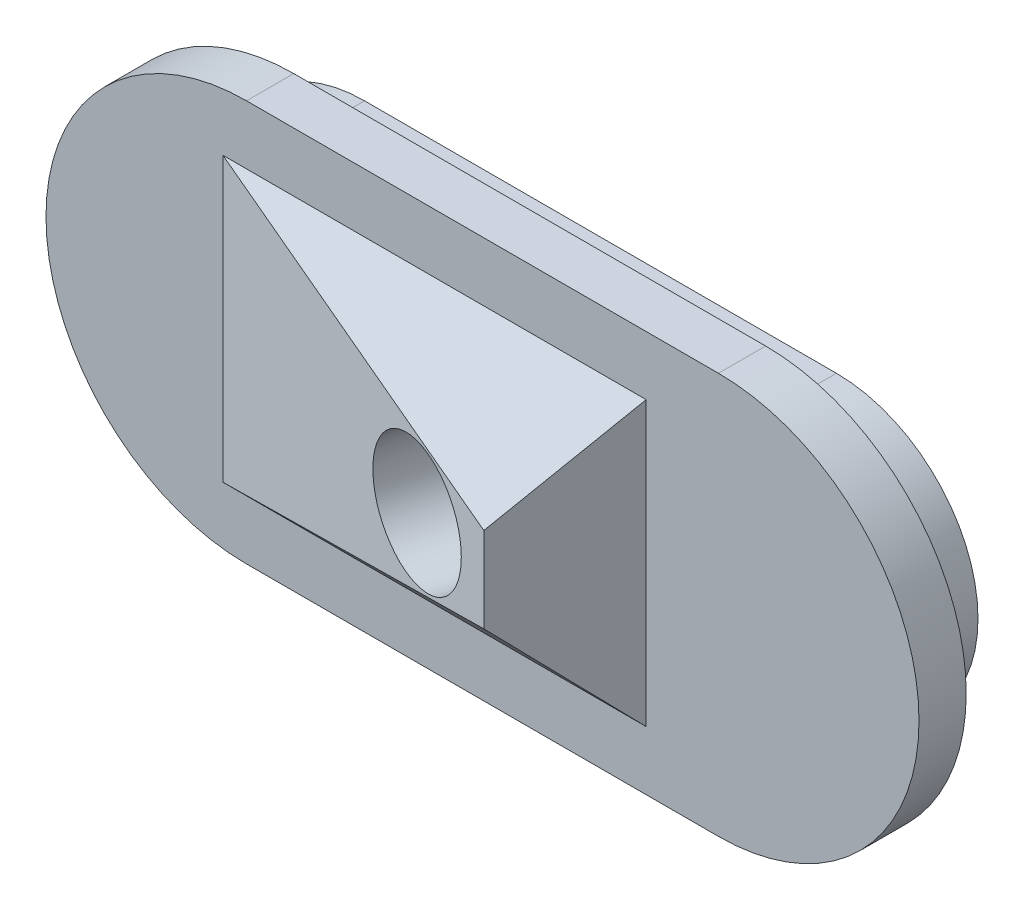
from build123d import *

# Parameters (mm, degrees)
BOSS_EXTRUDE1_DEPTH             = 5
BOSS_EXTRUDE2_REACH             = 19.804
BOSS_EXTRUDE2_DIRECTION_2_REACH = 19.804
BOSS_EXTRUDE3_DEPTH             = 2
SKETCH4_R                       = 2.65
CUT_EXTRUDE1_DEPTH              = 29.091194779
SKETCH9_W                       = 64.865756982
SKETCH9_H                       = 28.956889813
CUT_EXTRUDE2_DEPTH              = 32.5
CUT_EXTRUDE3_DEPTH              = 29.618053883
CHAMFER3_SIZE                   = 3
CHAMFER3_SIZE_2                 = 4.914912266


with BuildPart() as part:
    # Sketch2 → Boss-Extrude1 (new, symmetric)
    with BuildSketch(Plane.XY):
        with BuildLine():
            Line((-10, 6), (10, 6))
            ThreePointArc((10, 6), (16, 0), (10, -6))
            Line((10, -6), (-10, -6))
            ThreePointArc((-10, -6), (-16, 0), (-10, 6))
        make_face()
    extrude(amount=BOSS_EXTRUDE1_DEPTH, both=True)

    # Boss-Extrude2: up to this face of the body (flat: up to its plane)
    boss_extrude2_end = Plane(part.part.faces().sort_by_distance((0, 6, 0))[0])
    # Sketch3 → Boss-Extrude2 (add, up to the picked face)
    with BuildSketch(Plane(origin=(0, 0, 0), x_dir=(1, 0, 0), z_dir=(0, 1, 0)), mode=Mode.PRIVATE) as boss_extrude2_sk1:
        Polygon((-5, 5), (-5, 9.823085464), (13, 5), align=None)
    boss_extrude2_tool1 = split(extrude(boss_extrude2_sk1.sketch, amount=BOSS_EXTRUDE2_REACH, mode=Mode.PRIVATE), bisect_by=boss_extrude2_end, keep=Keep.BOTH, mode=Mode.PRIVATE)
    # Sketch3 → Boss-Extrude2 (add, up to the picked face)
    with BuildSketch(Plane(origin=(0, 0, 0), x_dir=(1, 0, 0), z_dir=(0, 1, 0)), mode=Mode.PRIVATE) as boss_extrude2_sk2:
        Polygon((-11, -5), (7, -9.823085464), (7, -5), align=None)
    boss_extrude2_tool2 = split(extrude(boss_extrude2_sk2.sketch, amount=BOSS_EXTRUDE2_REACH, mode=Mode.PRIVATE), bisect_by=boss_extrude2_end, keep=Keep.BOTH, mode=Mode.PRIVATE)
    add(boss_extrude2_tool1.solids().sort_by(Axis((1, 0, -6.607695), (0, 1, 0)))[0])
    add(boss_extrude2_tool2.solids().sort_by(Axis((1, 0, 6.607695), (0, 1, 0)))[0])

    # Boss-Extrude2 direction 2: up to this face of the body (flat: up to its plane)
    boss_extrude2_direction_2_end = Plane(part.part.faces().sort_by_distance((0, -6, 0))[0])
    # Sketch3 → Boss-Extrude2 direction 2 (add, up to the picked face)
    with BuildSketch(Plane(origin=(0, 0, 0), x_dir=(1, 0, 0), z_dir=(0, 1, 0)), mode=Mode.PRIVATE) as boss_extrude2_direction_2_sk1:
        Polygon((-5, 5), (-5, 9.823085464), (13, 5), align=None)
    boss_extrude2_direction_2_tool1 = split(extrude(boss_extrude2_direction_2_sk1.sketch, amount=-BOSS_EXTRUDE2_DIRECTION_2_REACH, mode=Mode.PRIVATE), bisect_by=boss_extrude2_direction_2_end, keep=Keep.BOTH, mode=Mode.PRIVATE)
    # Sketch3 → Boss-Extrude2 direction 2 (add, up to the picked face)
    with BuildSketch(Plane(origin=(0, 0, 0), x_dir=(1, 0, 0), z_dir=(0, 1, 0)), mode=Mode.PRIVATE) as boss_extrude2_direction_2_sk2:
        Polygon((-11, -5), (7, -9.823085464), (7, -5), align=None)
    boss_extrude2_direction_2_tool2 = split(extrude(boss_extrude2_direction_2_sk2.sketch, amount=-BOSS_EXTRUDE2_DIRECTION_2_REACH, mode=Mode.PRIVATE), bisect_by=boss_extrude2_direction_2_end, keep=Keep.BOTH, mode=Mode.PRIVATE)
    add(boss_extrude2_direction_2_tool1.solids().sort_by(Axis((1, 0, -6.607695), (0, -1, 0)))[0])
    add(boss_extrude2_direction_2_tool2.solids().sort_by(Axis((1, 0, 6.607695), (0, -1, 0)))[0])

    # Sketch8 → Boss-Extrude3 (add)
    with BuildSketch(Plane.XY.offset(5)):
        with BuildLine():
            Line((-10, 8.5), (10, 8.5))
            ThreePointArc((10, 8.5), (18.5, 0), (10, -8.5))
            Line((10, -8.5), (-10, -8.5))
            ThreePointArc((-10, -8.5), (-18.5, 0), (-10, 8.5))
        make_face()
    boss_extrude3 = extrude(amount=-BOSS_EXTRUDE3_DEPTH)

    # Mirror1: Boss-Extrude3 across plane
    add(boss_extrude3.mirror(Plane.XY))

    # Sketch4 → Cut-Extrude1 (cut, through all)
    with BuildSketch(Plane(origin=(-1.986860279, 0, 7.415063509), x_dir=(0.96592582628907, 0, 0.25881904510251436), z_dir=(-0.25881904510251436, 0, 0.96592582628907))):
        with Locations((2.303882384, 0)):
            Circle(SKETCH4_R)
    extrude(amount=-CUT_EXTRUDE1_DEPTH, mode=Mode.SUBTRACT)

    # Sketch9 → Cut-Extrude2 (cut, symmetric)
    with BuildSketch(Plane(origin=(0, 0, 0), x_dir=(1, 0, 0), z_dir=(0, 1, 0))):
        with Locations((0.241735823, 14.478444907)):
            Rectangle(SKETCH9_W, SKETCH9_H)
    extrude(amount=CUT_EXTRUDE2_DEPTH, both=True, mode=Mode.SUBTRACT)

    # Sketch10 → Cut-Extrude3 (cut, through all)
    with BuildSketch(Plane(origin=(7, 0, 0), x_dir=(0, 0, -1), z_dir=(1, 0, 0))):
        Polygon((-5, 6), (-9.823085464, 1), (-9.823085464, -1), (-5, -6), (-15.161694792, -6), (-15.161694792, 6), align=None)
    extrude(amount=-CUT_EXTRUDE3_DEPTH, mode=Mode.SUBTRACT)

    # Chamfer3
    # the kernel refuses this chamfer: 4.914912266, 3 mm, written as the material it takes off along each edge
    with BuildSketch(Plane(origin=(7, 13.693017634, 9.823085464), x_dir=(-0.9797390561393613, 0, -0.2002782611147635), z_dir=(0, -1, 0))) as chamfer3_piece_1_section:
        Polygon((CHAMFER3_SIZE * 0.998191085646, CHAMFER3_SIZE * 0.0601211821046), (CHAMFER3_SIZE_2 * 0.200278261104, CHAMFER3_SIZE_2 * 0.979739056086), (0, 0), align=None)
    chamfer3_piece_1 = extrude(amount=27.386035267, mode=Mode.PRIVATE)
    chamfer3_piece_1 = split(chamfer3_piece_1, bisect_by=Plane(origin=(6.06140933, 0, 5), z_dir=(0, 0, 1)), keep=Keep.TOP, mode=Mode.PRIVATE)
    add(chamfer3_piece_1, mode=Mode.SUBTRACT)


solid = part.part
